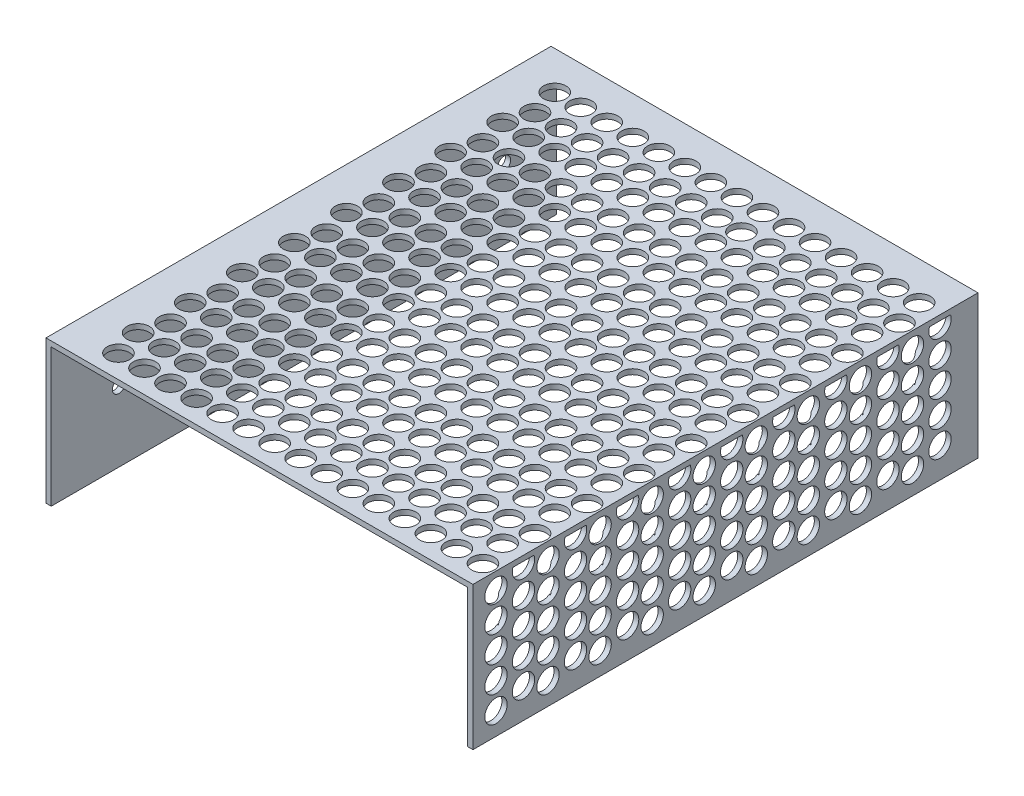
from build123d import *

# Parameters (mm, degrees)
EXTRUDE_1_DEPTH       = 99
CUT_EXTRUDE_1_DEPTH   = 132.67099149
SKETCH_3_R            = 2.15
CUT_EXTRUDE_2_DEPTH   = 10
HOLE_WIZARD_M31_D     = 2.5
HOLE_WIZARD_M31_DEPTH = 8.5
HOLE_WIZARD_M31_TIP   = 0.751075774
SKETCH_6_R            = 2.15
CUT_EXTRUDE_3_DEPTH   = 24


with BuildPart() as part:
    # Эскиз1 → Бобышка-Вытянуть1 (new body)
    with BuildSketch(Plane.XY):
        Polygon((81, 0), (81, 27.5), (1, 27.5), (1, 0), (0, 0), (0, 28.5), (82, 28.5), (82, 0), align=None)
    extrude(amount=EXTRUDE_1_DEPTH)

    # Эскиз2 → Вырез-Вытянуть1 (cut, through all)
    with BuildSketch(Plane(origin=(82, 0, 0), x_dir=(0, 0, -1), z_dir=(1, 0, 0))):
        Polygon((-98, 28.5), (-98, 1), (-1, 1), (-1, 28.5), (0, 28.5), (0, 0), (-99, 0), (-99, 28.5), align=None)
    extrude(amount=-CUT_EXTRUDE_1_DEPTH, mode=Mode.SUBTRACT)

    # Эскиз3 → Вырез-Вытянуть2 (cut)
    with BuildSketch(Plane(origin=(0, 28.5, 0), x_dir=(1, 0, 0), z_dir=(0, 1, 0))):
        with Locations((8, -8.3)):
            Circle(SKETCH_3_R)
        with Locations((9.5, -13.582039862)):
            Circle(SKETCH_3_R)
        with Locations((13, -8.3)):
            Circle(SKETCH_3_R)
        with Locations((14.5, -13.582039862)):
            Circle(SKETCH_3_R)
        with Locations((18, -8.3)):
            Circle(SKETCH_3_R)
        with Locations((19.5, -13.582039862)):
            Circle(SKETCH_3_R)
        with Locations((23, -8.3)):
            Circle(SKETCH_3_R)
        with Locations((24.5, -13.582039862)):
            Circle(SKETCH_3_R)
        with Locations((28, -8.3)):
            Circle(SKETCH_3_R)
        with Locations((29.5, -13.582039862)):
            Circle(SKETCH_3_R)
        with Locations((33, -8.3)):
            Circle(SKETCH_3_R)
        with Locations((34.5, -13.582039862)):
            Circle(SKETCH_3_R)
        with Locations((38, -8.3)):
            Circle(SKETCH_3_R)
        with Locations((39.5, -13.582039862)):
            Circle(SKETCH_3_R)
        with Locations((43, -8.3)):
            Circle(SKETCH_3_R)
        with Locations((44.5, -13.582039862)):
            Circle(SKETCH_3_R)
        with Locations((48, -8.3)):
            Circle(SKETCH_3_R)
        with Locations((8, -18.3)):
            Circle(SKETCH_3_R)
        with Locations((9.5, -23.582039862)):
            Circle(SKETCH_3_R)
        with Locations((13, -18.3)):
            Circle(SKETCH_3_R)
        with Locations((14.5, -23.582039862)):
            Circle(SKETCH_3_R)
        with Locations((18, -18.3)):
            Circle(SKETCH_3_R)
        with Locations((19.5, -23.582039862)):
            Circle(SKETCH_3_R)
        with Locations((23, -18.3)):
            Circle(SKETCH_3_R)
        with Locations((24.5, -23.582039862)):
            Circle(SKETCH_3_R)
        with Locations((28, -18.3)):
            Circle(SKETCH_3_R)
        with Locations((29.5, -23.582039862)):
            Circle(SKETCH_3_R)
        with Locations((33, -18.3)):
            Circle(SKETCH_3_R)
        with Locations((34.5, -23.582039862)):
            Circle(SKETCH_3_R)
        with Locations((38, -18.3)):
            Circle(SKETCH_3_R)
        with Locations((39.5, -23.582039862)):
            Circle(SKETCH_3_R)
        with Locations((43, -18.3)):
            Circle(SKETCH_3_R)
        with Locations((44.5, -23.582039862)):
            Circle(SKETCH_3_R)
        with Locations((48, -18.3)):
            Circle(SKETCH_3_R)
        with Locations((8, -28.3)):
            Circle(SKETCH_3_R)
        with Locations((9.5, -33.582039862)):
            Circle(SKETCH_3_R)
        with Locations((13, -28.3)):
            Circle(SKETCH_3_R)
        with Locations((14.5, -33.582039862)):
            Circle(SKETCH_3_R)
        with Locations((18, -28.3)):
            Circle(SKETCH_3_R)
        with Locations((19.5, -33.582039862)):
            Circle(SKETCH_3_R)
        with Locations((23, -28.3)):
            Circle(SKETCH_3_R)
        with Locations((24.5, -33.582039862)):
            Circle(SKETCH_3_R)
        with Locations((28, -28.3)):
            Circle(SKETCH_3_R)
        with Locations((29.5, -33.582039862)):
            Circle(SKETCH_3_R)
        with Locations((33, -28.3)):
            Circle(SKETCH_3_R)
        with Locations((34.5, -33.582039862)):
            Circle(SKETCH_3_R)
        with Locations((38, -28.3)):
            Circle(SKETCH_3_R)
        with Locations((39.5, -33.582039862)):
            Circle(SKETCH_3_R)
        with Locations((43, -28.3)):
            Circle(SKETCH_3_R)
        with Locations((44.5, -33.582039862)):
            Circle(SKETCH_3_R)
        with Locations((48, -28.3)):
            Circle(SKETCH_3_R)
        with Locations((8, -38.3)):
            Circle(SKETCH_3_R)
        with Locations((9.5, -43.582039862)):
            Circle(SKETCH_3_R)
        with Locations((13, -38.3)):
            Circle(SKETCH_3_R)
        with Locations((14.5, -43.582039862)):
            Circle(SKETCH_3_R)
        with Locations((18, -38.3)):
            Circle(SKETCH_3_R)
        with Locations((19.5, -43.582039862)):
            Circle(SKETCH_3_R)
        with Locations((23, -38.3)):
            Circle(SKETCH_3_R)
        with Locations((24.5, -43.582039862)):
            Circle(SKETCH_3_R)
        with Locations((28, -38.3)):
            Circle(SKETCH_3_R)
        with Locations((29.5, -43.582039862)):
            Circle(SKETCH_3_R)
        with Locations((33, -38.3)):
            Circle(SKETCH_3_R)
        with Locations((34.5, -43.582039862)):
            Circle(SKETCH_3_R)
        with Locations((38, -38.3)):
            Circle(SKETCH_3_R)
        with Locations((39.5, -43.582039862)):
            Circle(SKETCH_3_R)
        with Locations((43, -38.3)):
            Circle(SKETCH_3_R)
        with Locations((44.5, -43.582039862)):
            Circle(SKETCH_3_R)
        with Locations((48, -38.3)):
            Circle(SKETCH_3_R)
        with Locations((8, -48.3)):
            Circle(SKETCH_3_R)
        with Locations((9.5, -53.582039862)):
            Circle(SKETCH_3_R)
        with Locations((13, -48.3)):
            Circle(SKETCH_3_R)
        with Locations((14.5, -53.582039862)):
            Circle(SKETCH_3_R)
        with Locations((18, -48.3)):
            Circle(SKETCH_3_R)
        with Locations((19.5, -53.582039862)):
            Circle(SKETCH_3_R)
        with Locations((23, -48.3)):
            Circle(SKETCH_3_R)
        with Locations((24.5, -53.582039862)):
            Circle(SKETCH_3_R)
        with Locations((28, -48.3)):
            Circle(SKETCH_3_R)
        with Locations((29.5, -53.582039862)):
            Circle(SKETCH_3_R)
        with Locations((33, -48.3)):
            Circle(SKETCH_3_R)
        with Locations((34.5, -53.582039862)):
            Circle(SKETCH_3_R)
        with Locations((38, -48.3)):
            Circle(SKETCH_3_R)
        with Locations((39.5, -53.582039862)):
            Circle(SKETCH_3_R)
        with Locations((43, -48.3)):
            Circle(SKETCH_3_R)
        with Locations((44.5, -53.582039862)):
            Circle(SKETCH_3_R)
        with Locations((48, -48.3)):
            Circle(SKETCH_3_R)
        with Locations((8, -58.3)):
            Circle(SKETCH_3_R)
        with Locations((9.5, -63.582039862)):
            Circle(SKETCH_3_R)
        with Locations((13, -58.3)):
            Circle(SKETCH_3_R)
        with Locations((14.5, -63.582039862)):
            Circle(SKETCH_3_R)
        with Locations((18, -58.3)):
            Circle(SKETCH_3_R)
        with Locations((19.5, -63.582039862)):
            Circle(SKETCH_3_R)
        with Locations((23, -58.3)):
            Circle(SKETCH_3_R)
        with Locations((24.5, -63.582039862)):
            Circle(SKETCH_3_R)
        with Locations((28, -58.3)):
            Circle(SKETCH_3_R)
        with Locations((29.5, -63.582039862)):
            Circle(SKETCH_3_R)
        with Locations((33, -58.3)):
            Circle(SKETCH_3_R)
        with Locations((34.5, -63.582039862)):
            Circle(SKETCH_3_R)
        with Locations((38, -58.3)):
            Circle(SKETCH_3_R)
        with Locations((39.5, -63.582039862)):
            Circle(SKETCH_3_R)
        with Locations((43, -58.3)):
            Circle(SKETCH_3_R)
        with Locations((44.5, -63.582039862)):
            Circle(SKETCH_3_R)
        with Locations((48, -58.3)):
            Circle(SKETCH_3_R)
        with Locations((8, -68.3)):
            Circle(SKETCH_3_R)
        with Locations((9.5, -73.582039862)):
            Circle(SKETCH_3_R)
        with Locations((13, -68.3)):
            Circle(SKETCH_3_R)
        with Locations((14.5, -73.582039862)):
            Circle(SKETCH_3_R)
        with Locations((18, -68.3)):
            Circle(SKETCH_3_R)
        with Locations((19.5, -73.582039862)):
            Circle(SKETCH_3_R)
        with Locations((23, -68.3)):
            Circle(SKETCH_3_R)
        with Locations((24.5, -73.582039862)):
            Circle(SKETCH_3_R)
        with Locations((28, -68.3)):
            Circle(SKETCH_3_R)
        with Locations((29.5, -73.582039862)):
            Circle(SKETCH_3_R)
        with Locations((33, -68.3)):
            Circle(SKETCH_3_R)
        with Locations((34.5, -73.582039862)):
            Circle(SKETCH_3_R)
        with Locations((38, -68.3)):
            Circle(SKETCH_3_R)
        with Locations((39.5, -73.582039862)):
            Circle(SKETCH_3_R)
        with Locations((43, -68.3)):
            Circle(SKETCH_3_R)
        with Locations((44.5, -73.582039862)):
            Circle(SKETCH_3_R)
        with Locations((48, -68.3)):
            Circle(SKETCH_3_R)
        with Locations((8, -78.3)):
            Circle(SKETCH_3_R)
        with Locations((9.5, -83.582039862)):
            Circle(SKETCH_3_R)
        with Locations((13, -78.3)):
            Circle(SKETCH_3_R)
        with Locations((14.5, -83.582039862)):
            Circle(SKETCH_3_R)
        with Locations((18, -78.3)):
            Circle(SKETCH_3_R)
        with Locations((19.5, -83.582039862)):
            Circle(SKETCH_3_R)
        with Locations((23, -78.3)):
            Circle(SKETCH_3_R)
        with Locations((24.5, -83.582039862)):
            Circle(SKETCH_3_R)
        with Locations((28, -78.3)):
            Circle(SKETCH_3_R)
        with Locations((29.5, -83.582039862)):
            Circle(SKETCH_3_R)
        with Locations((33, -78.3)):
            Circle(SKETCH_3_R)
        with Locations((34.5, -83.582039862)):
            Circle(SKETCH_3_R)
        with Locations((38, -78.3)):
            Circle(SKETCH_3_R)
        with Locations((39.5, -83.582039862)):
            Circle(SKETCH_3_R)
        with Locations((43, -78.3)):
            Circle(SKETCH_3_R)
        with Locations((44.5, -83.582039862)):
            Circle(SKETCH_3_R)
        with Locations((48, -78.3)):
            Circle(SKETCH_3_R)
        with Locations((8, -88.3)):
            Circle(SKETCH_3_R)
        with Locations((9.5, -93.582039862)):
            Circle(SKETCH_3_R)
        with Locations((13, -88.3)):
            Circle(SKETCH_3_R)
        with Locations((14.5, -93.582039862)):
            Circle(SKETCH_3_R)
        with Locations((18, -88.3)):
            Circle(SKETCH_3_R)
        with Locations((19.5, -93.582039862)):
            Circle(SKETCH_3_R)
        with Locations((23, -88.3)):
            Circle(SKETCH_3_R)
        with Locations((24.5, -93.582039862)):
            Circle(SKETCH_3_R)
        with Locations((28, -88.3)):
            Circle(SKETCH_3_R)
        with Locations((29.5, -93.582039862)):
            Circle(SKETCH_3_R)
        with Locations((33, -88.3)):
            Circle(SKETCH_3_R)
        with Locations((34.5, -93.582039862)):
            Circle(SKETCH_3_R)
        with Locations((38, -88.3)):
            Circle(SKETCH_3_R)
        with Locations((39.5, -93.582039862)):
            Circle(SKETCH_3_R)
        with Locations((43, -88.3)):
            Circle(SKETCH_3_R)
        with Locations((44.5, -93.582039862)):
            Circle(SKETCH_3_R)
        with Locations((48, -88.3)):
            Circle(SKETCH_3_R)
        with Locations((53, -8.3)):
            Circle(SKETCH_3_R)
        with Locations((54.5, -13.582039862)):
            Circle(SKETCH_3_R)
        with Locations((58, -8.3)):
            Circle(SKETCH_3_R)
        with Locations((59.5, -13.582039862)):
            Circle(SKETCH_3_R)
        with Locations((63, -8.3)):
            Circle(SKETCH_3_R)
        with Locations((64.5, -13.582039862)):
            Circle(SKETCH_3_R)
        with Locations((68, -8.3)):
            Circle(SKETCH_3_R)
        with Locations((69.5, -13.582039862)):
            Circle(SKETCH_3_R)
        with Locations((73, -8.3)):
            Circle(SKETCH_3_R)
        with Locations((53, -18.3)):
            Circle(SKETCH_3_R)
        with Locations((54.5, -23.582039862)):
            Circle(SKETCH_3_R)
        with Locations((58, -18.3)):
            Circle(SKETCH_3_R)
        with Locations((59.5, -23.582039862)):
            Circle(SKETCH_3_R)
        with Locations((63, -18.3)):
            Circle(SKETCH_3_R)
        with Locations((64.5, -23.582039862)):
            Circle(SKETCH_3_R)
        with Locations((68, -18.3)):
            Circle(SKETCH_3_R)
        with Locations((69.5, -23.582039862)):
            Circle(SKETCH_3_R)
        with Locations((73, -18.3)):
            Circle(SKETCH_3_R)
        with Locations((53, -28.3)):
            Circle(SKETCH_3_R)
        with Locations((54.5, -33.582039862)):
            Circle(SKETCH_3_R)
        with Locations((58, -28.3)):
            Circle(SKETCH_3_R)
        with Locations((59.5, -33.582039862)):
            Circle(SKETCH_3_R)
        with Locations((63, -28.3)):
            Circle(SKETCH_3_R)
        with Locations((64.5, -33.582039862)):
            Circle(SKETCH_3_R)
        with Locations((68, -28.3)):
            Circle(SKETCH_3_R)
        with Locations((69.5, -33.582039862)):
            Circle(SKETCH_3_R)
        with Locations((73, -28.3)):
            Circle(SKETCH_3_R)
        with Locations((53, -38.3)):
            Circle(SKETCH_3_R)
        with Locations((54.5, -43.582039862)):
            Circle(SKETCH_3_R)
        with Locations((58, -38.3)):
            Circle(SKETCH_3_R)
        with Locations((59.5, -43.582039862)):
            Circle(SKETCH_3_R)
        with Locations((63, -38.3)):
            Circle(SKETCH_3_R)
        with Locations((64.5, -43.582039862)):
            Circle(SKETCH_3_R)
        with Locations((68, -38.3)):
            Circle(SKETCH_3_R)
        with Locations((69.5, -43.582039862)):
            Circle(SKETCH_3_R)
        with Locations((73, -38.3)):
            Circle(SKETCH_3_R)
        with Locations((53, -48.3)):
            Circle(SKETCH_3_R)
        with Locations((54.5, -53.582039862)):
            Circle(SKETCH_3_R)
        with Locations((58, -48.3)):
            Circle(SKETCH_3_R)
        with Locations((59.5, -53.582039862)):
            Circle(SKETCH_3_R)
        with Locations((63, -48.3)):
            Circle(SKETCH_3_R)
        with Locations((64.5, -53.582039862)):
            Circle(SKETCH_3_R)
        with Locations((68, -48.3)):
            Circle(SKETCH_3_R)
        with Locations((69.5, -53.582039862)):
            Circle(SKETCH_3_R)
        with Locations((73, -48.3)):
            Circle(SKETCH_3_R)
        with Locations((53, -58.3)):
            Circle(SKETCH_3_R)
        with Locations((54.5, -63.582039862)):
            Circle(SKETCH_3_R)
        with Locations((58, -58.3)):
            Circle(SKETCH_3_R)
        with Locations((59.5, -63.582039862)):
            Circle(SKETCH_3_R)
        with Locations((63, -58.3)):
            Circle(SKETCH_3_R)
        with Locations((64.5, -63.582039862)):
            Circle(SKETCH_3_R)
        with Locations((68, -58.3)):
            Circle(SKETCH_3_R)
        with Locations((69.5, -63.582039862)):
            Circle(SKETCH_3_R)
        with Locations((73, -58.3)):
            Circle(SKETCH_3_R)
        with Locations((53, -68.3)):
            Circle(SKETCH_3_R)
        with Locations((54.5, -73.582039862)):
            Circle(SKETCH_3_R)
        with Locations((58, -68.3)):
            Circle(SKETCH_3_R)
        with Locations((59.5, -73.582039862)):
            Circle(SKETCH_3_R)
        with Locations((63, -68.3)):
            Circle(SKETCH_3_R)
        with Locations((64.5, -73.582039862)):
            Circle(SKETCH_3_R)
        with Locations((68, -68.3)):
            Circle(SKETCH_3_R)
        with Locations((69.5, -73.582039862)):
            Circle(SKETCH_3_R)
        with Locations((73, -68.3)):
            Circle(SKETCH_3_R)
        with Locations((53, -78.3)):
            Circle(SKETCH_3_R)
        with Locations((54.5, -83.582039862)):
            Circle(SKETCH_3_R)
        with Locations((58, -78.3)):
            Circle(SKETCH_3_R)
        with Locations((59.5, -83.582039862)):
            Circle(SKETCH_3_R)
        with Locations((63, -78.3)):
            Circle(SKETCH_3_R)
        with Locations((64.5, -83.582039862)):
            Circle(SKETCH_3_R)
        with Locations((68, -78.3)):
            Circle(SKETCH_3_R)
        with Locations((69.5, -83.582039862)):
            Circle(SKETCH_3_R)
        with Locations((73, -78.3)):
            Circle(SKETCH_3_R)
        with Locations((53, -88.3)):
            Circle(SKETCH_3_R)
        with Locations((54.5, -93.582039862)):
            Circle(SKETCH_3_R)
        with Locations((58, -88.3)):
            Circle(SKETCH_3_R)
        with Locations((59.5, -93.582039862)):
            Circle(SKETCH_3_R)
        with Locations((63, -88.3)):
            Circle(SKETCH_3_R)
        with Locations((64.5, -93.582039862)):
            Circle(SKETCH_3_R)
        with Locations((68, -88.3)):
            Circle(SKETCH_3_R)
        with Locations((69.5, -93.582039862)):
            Circle(SKETCH_3_R)
        with Locations((73, -88.3)):
            Circle(SKETCH_3_R)
        with Locations((49.151296387, -13.582039862)):
            Circle(SKETCH_3_R)
        with Locations((49.5, -93.582039862)):
            Circle(SKETCH_3_R)
        with Locations((49.5, -83.582039862)):
            Circle(SKETCH_3_R)
        with Locations((49.5, -73.582039862)):
            Circle(SKETCH_3_R)
        with Locations((49.5, -63.582039862)):
            Circle(SKETCH_3_R)
        with Locations((49.5, -53.582039862)):
            Circle(SKETCH_3_R)
        with Locations((49.5, -43.582039862)):
            Circle(SKETCH_3_R)
        with Locations((49.5, -33.582039862)):
            Circle(SKETCH_3_R)
        with Locations((49.5, -23.582039862)):
            Circle(SKETCH_3_R)
        with Locations((78, -8.3)):
            Circle(SKETCH_3_R)
        with Locations((79.5, -13.582039862)):
            Circle(SKETCH_3_R)
        with Locations((78, -18.3)):
            Circle(SKETCH_3_R)
        with Locations((79.5, -23.582039862)):
            Circle(SKETCH_3_R)
        with Locations((78, -28.3)):
            Circle(SKETCH_3_R)
        with Locations((79.5, -33.582039862)):
            Circle(SKETCH_3_R)
        with Locations((78, -38.3)):
            Circle(SKETCH_3_R)
        with Locations((79.5, -43.582039862)):
            Circle(SKETCH_3_R)
        with Locations((78, -48.3)):
            Circle(SKETCH_3_R)
        with Locations((79.5, -53.582039862)):
            Circle(SKETCH_3_R)
        with Locations((78, -58.3)):
            Circle(SKETCH_3_R)
        with Locations((79.5, -63.582039862)):
            Circle(SKETCH_3_R)
        with Locations((78, -68.3)):
            Circle(SKETCH_3_R)
        with Locations((79.5, -73.582039862)):
            Circle(SKETCH_3_R)
        with Locations((78, -78.3)):
            Circle(SKETCH_3_R)
        with Locations((79.5, -83.582039862)):
            Circle(SKETCH_3_R)
        with Locations((78, -88.3)):
            Circle(SKETCH_3_R)
        with Locations((79.5, -93.582039862)):
            Circle(SKETCH_3_R)
        with Locations((74.5, -13.582039862)):
            Circle(SKETCH_3_R)
        with Locations((74.5, -23.582039862)):
            Circle(SKETCH_3_R)
        with Locations((74.5, -33.582039862)):
            Circle(SKETCH_3_R)
        with Locations((74.5, -43.582039862)):
            Circle(SKETCH_3_R)
        with Locations((74.5, -53.582039862)):
            Circle(SKETCH_3_R)
        with Locations((74.5, -63.582039862)):
            Circle(SKETCH_3_R)
        with Locations((74.5, -73.582039862)):
            Circle(SKETCH_3_R)
        with Locations((74.5, -83.582039862)):
            Circle(SKETCH_3_R)
        with Locations((74.5, -93.582039862)):
            Circle(SKETCH_3_R)
    extrude(amount=-CUT_EXTRUDE_2_DEPTH, mode=Mode.SUBTRACT)

    # Отверстие обработанное метчиком M31
    with Locations(Plane.ZY):
        with Locations((85, 14.5), (11, 14.5)):
            Hole(HOLE_WIZARD_M31_D / 2, depth=HOLE_WIZARD_M31_DEPTH)
            with Locations((0, 0, -(HOLE_WIZARD_M31_DEPTH + HOLE_WIZARD_M31_TIP / 2))):  # 118° drill point
                Cone(0, HOLE_WIZARD_M31_D / 2, HOLE_WIZARD_M31_TIP, mode=Mode.SUBTRACT)

    # Эскиз6 → Вырез-Вытянуть3 (cut)
    with BuildSketch(Plane(origin=(82, 0, 0), x_dir=(0, 0, -1), z_dir=(1, 0, 0))):
        with Locations((-73.58, 5.272663972)):
            Circle(SKETCH_6_R)
        with Locations((-68.297960138, 6.772663972)):
            Circle(SKETCH_6_R)
        with Locations((-73.58, 10.272663972)):
            Circle(SKETCH_6_R)
        with Locations((-68.297960138, 11.772663972)):
            Circle(SKETCH_6_R)
        with Locations((-73.58, 15.272663972)):
            Circle(SKETCH_6_R)
        with Locations((-68.297960138, 16.772663972)):
            Circle(SKETCH_6_R)
        with Locations((-73.58, 20.272663972)):
            Circle(SKETCH_6_R)
        with Locations((-68.297960138, 21.772663972)):
            Circle(SKETCH_6_R)
        with Locations((-73.58, 25.272663972)):
            Circle(SKETCH_6_R)
        with Locations((-63.58, 5.272663972)):
            Circle(SKETCH_6_R)
        with Locations((-58.297960138, 6.772663972)):
            Circle(SKETCH_6_R)
        with Locations((-63.58, 10.272663972)):
            Circle(SKETCH_6_R)
        with Locations((-58.297960138, 11.772663972)):
            Circle(SKETCH_6_R)
        with Locations((-63.58, 15.272663972)):
            Circle(SKETCH_6_R)
        with Locations((-58.297960138, 16.772663972)):
            Circle(SKETCH_6_R)
        with Locations((-63.58, 20.272663972)):
            Circle(SKETCH_6_R)
        with Locations((-58.297960138, 21.772663972)):
            Circle(SKETCH_6_R)
        with Locations((-63.58, 25.272663972)):
            Circle(SKETCH_6_R)
        with Locations((-53.58, 5.272663972)):
            Circle(SKETCH_6_R)
        with Locations((-48.297960138, 6.772663972)):
            Circle(SKETCH_6_R)
        with Locations((-53.58, 10.272663972)):
            Circle(SKETCH_6_R)
        with Locations((-48.297960138, 11.772663972)):
            Circle(SKETCH_6_R)
        with Locations((-53.58, 15.272663972)):
            Circle(SKETCH_6_R)
        with Locations((-48.297960138, 16.772663972)):
            Circle(SKETCH_6_R)
        with Locations((-53.58, 20.272663972)):
            Circle(SKETCH_6_R)
        with Locations((-48.297960138, 21.772663972)):
            Circle(SKETCH_6_R)
        with Locations((-53.58, 25.272663972)):
            Circle(SKETCH_6_R)
        with Locations((-43.58, 5.272663972)):
            Circle(SKETCH_6_R)
        with Locations((-38.297960138, 6.772663972)):
            Circle(SKETCH_6_R)
        with Locations((-43.58, 10.272663972)):
            Circle(SKETCH_6_R)
        with Locations((-38.297960138, 11.772663972)):
            Circle(SKETCH_6_R)
        with Locations((-43.58, 15.272663972)):
            Circle(SKETCH_6_R)
        with Locations((-38.297960138, 16.772663972)):
            Circle(SKETCH_6_R)
        with Locations((-43.58, 20.272663972)):
            Circle(SKETCH_6_R)
        with Locations((-38.297960138, 21.772663972)):
            Circle(SKETCH_6_R)
        with Locations((-43.58, 25.272663972)):
            Circle(SKETCH_6_R)
        with Locations((-33.58, 5.272663972)):
            Circle(SKETCH_6_R)
        with Locations((-28.297960138, 6.772663972)):
            Circle(SKETCH_6_R)
        with Locations((-33.58, 10.272663972)):
            Circle(SKETCH_6_R)
        with Locations((-28.297960138, 11.772663972)):
            Circle(SKETCH_6_R)
        with Locations((-33.58, 15.272663972)):
            Circle(SKETCH_6_R)
        with Locations((-28.297960138, 16.772663972)):
            Circle(SKETCH_6_R)
        with Locations((-33.58, 20.272663972)):
            Circle(SKETCH_6_R)
        with Locations((-28.297960138, 21.772663972)):
            Circle(SKETCH_6_R)
        with Locations((-33.58, 25.272663972)):
            Circle(SKETCH_6_R)
        with Locations((-23.58, 5.272663972)):
            Circle(SKETCH_6_R)
        with Locations((-18.297960138, 6.772663972)):
            Circle(SKETCH_6_R)
        with Locations((-23.58, 10.272663972)):
            Circle(SKETCH_6_R)
        with Locations((-18.297960138, 11.772663972)):
            Circle(SKETCH_6_R)
        with Locations((-23.58, 15.272663972)):
            Circle(SKETCH_6_R)
        with Locations((-18.297960138, 16.772663972)):
            Circle(SKETCH_6_R)
        with Locations((-23.58, 20.272663972)):
            Circle(SKETCH_6_R)
        with Locations((-18.297960138, 21.772663972)):
            Circle(SKETCH_6_R)
        with Locations((-23.58, 25.272663972)):
            Circle(SKETCH_6_R)
        with Locations((-13.58, 5.272663972)):
            Circle(SKETCH_6_R)
        with Locations((-8.297960138, 6.772663972)):
            Circle(SKETCH_6_R)
        with Locations((-13.58, 10.272663972)):
            Circle(SKETCH_6_R)
        with Locations((-8.297960138, 11.772663972)):
            Circle(SKETCH_6_R)
        with Locations((-13.58, 15.272663972)):
            Circle(SKETCH_6_R)
        with Locations((-8.297960138, 16.772663972)):
            Circle(SKETCH_6_R)
        with Locations((-13.58, 20.272663972)):
            Circle(SKETCH_6_R)
        with Locations((-8.297960138, 21.772663972)):
            Circle(SKETCH_6_R)
        with Locations((-13.58, 25.272663972)):
            Circle(SKETCH_6_R)
        with Locations((-93.58, 5.272663972)):
            Circle(SKETCH_6_R)
        with Locations((-88.297960138, 6.772663972)):
            Circle(SKETCH_6_R)
        with Locations((-93.58, 10.272663972)):
            Circle(SKETCH_6_R)
        with Locations((-88.297960138, 11.772663972)):
            Circle(SKETCH_6_R)
        with Locations((-93.58, 15.272663972)):
            Circle(SKETCH_6_R)
        with Locations((-88.297960138, 16.772663972)):
            Circle(SKETCH_6_R)
        with Locations((-93.58, 20.272663972)):
            Circle(SKETCH_6_R)
        with Locations((-88.297960138, 21.772663972)):
            Circle(SKETCH_6_R)
        with Locations((-93.58, 25.272663972)):
            Circle(SKETCH_6_R)
        with Locations((-83.58, 5.272663972)):
            Circle(SKETCH_6_R)
        with Locations((-78.297960138, 6.772663972)):
            Circle(SKETCH_6_R)
        with Locations((-83.58, 10.272663972)):
            Circle(SKETCH_6_R)
        with Locations((-78.297960138, 11.772663972)):
            Circle(SKETCH_6_R)
        with Locations((-83.58, 15.272663972)):
            Circle(SKETCH_6_R)
        with Locations((-78.297960138, 16.772663972)):
            Circle(SKETCH_6_R)
        with Locations((-83.58, 20.272663972)):
            Circle(SKETCH_6_R)
        with Locations((-78.297960138, 21.772663972)):
            Circle(SKETCH_6_R)
        with Locations((-83.58, 25.272663972)):
            Circle(SKETCH_6_R)
        with BuildLine():
            Line((-60.32119574, 27.5), (-56.274724535, 27.5))
            ThreePointArc((-56.274724535, 27.5), (-58.297960138, 24.622663972), (-60.32119574, 27.5))
        make_face()
        with BuildLine():
            Line((-70.32119574, 27.5), (-66.274724535, 27.5))
            ThreePointArc((-66.274724535, 27.5), (-68.297960138, 24.622663972), (-70.32119574, 27.5))
        make_face()
        with BuildLine():
            Line((-50.32119574, 27.5), (-46.274724535, 27.5))
            ThreePointArc((-46.274724535, 27.5), (-48.297960138, 24.622663972), (-50.32119574, 27.5))
        make_face()
        with BuildLine():
            Line((-40.32119574, 27.5), (-36.274724535, 27.5))
            ThreePointArc((-36.274724535, 27.5), (-38.297960138, 24.622663972), (-40.32119574, 27.5))
        make_face()
        with BuildLine():
            Line((-30.32119574, 27.5), (-26.274724535, 27.5))
            ThreePointArc((-26.274724535, 27.5), (-28.297960138, 24.622663972), (-30.32119574, 27.5))
        make_face()
        with BuildLine():
            Line((-20.32119574, 27.5), (-16.274724535, 27.5))
            ThreePointArc((-16.274724535, 27.5), (-18.297960138, 24.622663972), (-20.32119574, 27.5))
        make_face()
        with BuildLine():
            Line((-10.32119574, 27.5), (-6.274724535, 27.5))
            ThreePointArc((-6.274724535, 27.5), (-8.297960138, 24.622663972), (-10.32119574, 27.5))
        make_face()
        with BuildLine():
            Line((-90.32119574, 27.5), (-86.274724535, 27.5))
            ThreePointArc((-86.274724535, 27.5), (-88.297960138, 24.622663972), (-90.32119574, 27.5))
        make_face()
        with BuildLine():
            Line((-80.32119574, 27.5), (-76.274724535, 27.5))
            ThreePointArc((-76.274724535, 27.5), (-78.297960138, 24.622663972), (-80.32119574, 27.5))
        make_face()
    extrude(amount=-CUT_EXTRUDE_3_DEPTH, mode=Mode.SUBTRACT)


solid = part.part
